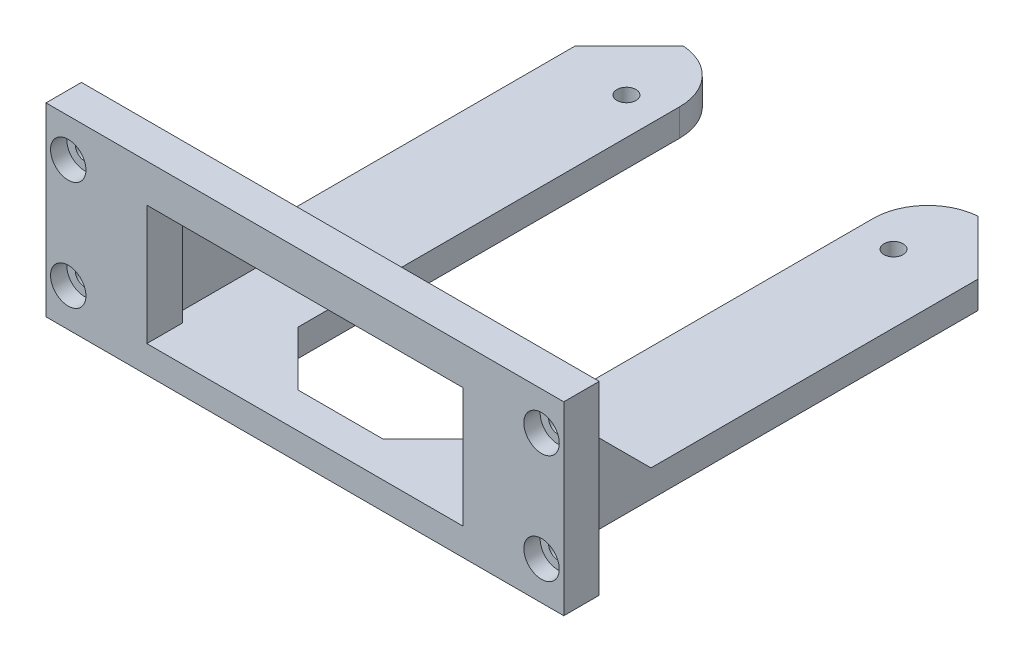
from build123d import *

# Parameters (mm, degrees)
SKETCH1_W                      = 95
SKETCH1_H                      = 34
BOSS_EXTRUDE1_DEPTH            = 6.5
SKETCH2_W                      = 74
SKETCH2_H                      = 5
BOSS_EXTRUDE2_DEPTH            = 90
SKETCH3_W                      = 58
SKETCH3_H                      = 22
CUT_EXTRUDE1_DEPTH             = 90
CBORE_FOR_M3_SHCS1_D           = 3.4
CBORE_FOR_M3_SHCS1_DEPTH       = 10.1
CBORE_FOR_M3_SHCS1_CBORE_D     = 6.5
CBORE_FOR_M3_SHCS1_CBORE_DEPTH = 3
CBORE_FOR_M3_SHCS1_TIP         = 1.021463052
SKETCH7_W                      = 6
SKETCH7_H                      = 20
BOSS_EXTRUDE3_DEPTH            = 20
CHAMFER1_SIZE                  = 20
F_1_0_3_5_DIAMETER_HOLE1_D     = 3.5
F_1_0_3_5_DIAMETER_HOLE1_DEPTH = 10.1
F_1_0_3_5_DIAMETER_HOLE1_TIP   = 1.051506083
SKETCH12_W                     = 35.5
SKETCH12_H                     = 90
CUT_EXTRUDE2_DEPTH             = 20
CHAMFER2_SIZE                  = 10
FILLET1_R                      = 10


# Some blends are built 0.0001 mm under size
with BuildPart() as part:
    # Sketch1 → Boss-Extrude1 (new body)
    with BuildSketch(Plane.XY):
        Rectangle(SKETCH1_W, SKETCH1_H)
    extrude(amount=BOSS_EXTRUDE1_DEPTH)

    # Sketch2 → Boss-Extrude2 (add)
    with BuildSketch(Plane(origin=(0, 0, 0), x_dir=(-1, 0, 0), z_dir=(0, 0, -1))):
        with Locations((0, -14.5)):
            Rectangle(SKETCH2_W, SKETCH2_H)
    extrude(amount=BOSS_EXTRUDE2_DEPTH)

    # Sketch3 → Cut-Extrude1 (cut)
    with BuildSketch(Plane(origin=(0, 0, 0), x_dir=(-1, 0, 0), z_dir=(0, 0, -1))):
        with Locations((0, -1)):
            Rectangle(SKETCH3_W, SKETCH3_H)
    extrude(amount=-CUT_EXTRUDE1_DEPTH, mode=Mode.SUBTRACT)

    # CBORE for M3 SHCS1
    with Locations(Plane.XY.offset(6.5)):
        with Locations((-43.42, 10), (-43.42, -10), (43.42, 10), (43.42, -10)):
            CounterBoreHole(CBORE_FOR_M3_SHCS1_D / 2, CBORE_FOR_M3_SHCS1_CBORE_D / 2, CBORE_FOR_M3_SHCS1_CBORE_DEPTH, depth=CBORE_FOR_M3_SHCS1_DEPTH)
            with Locations((0, 0, -(CBORE_FOR_M3_SHCS1_DEPTH + CBORE_FOR_M3_SHCS1_TIP / 2))):  # 118° drill point
                Cone(0, CBORE_FOR_M3_SHCS1_D / 2, CBORE_FOR_M3_SHCS1_TIP, mode=Mode.SUBTRACT)

    # Sketch7 → Boss-Extrude3 (add)
    with BuildSketch(Plane(origin=(0, 0, 0), x_dir=(-1, 0, 0), z_dir=(0, 0, -1))):
        with Locations((-34, -2)):
            Rectangle(SKETCH7_W, SKETCH7_H)
        with Locations((34, -2)):
            Rectangle(SKETCH7_W, SKETCH7_H)
    extrude(amount=BOSS_EXTRUDE3_DEPTH)

    # Chamfer1
    chamfer1_edges = [part.edges().sort_by_distance(p)[0] for p in [
        (34, 8, -20),
        (-34, 8, -20),
    ]]
    chamfer(chamfer1_edges, length=CHAMFER1_SIZE - 0.0001)  # a hair under: the kernel refuses the full size

    # Ø1.0 (3.5) Diameter Hole1
    with Locations(Plane(origin=(0, -12, 0), x_dir=(1, 0, 0), z_dir=(0, 1, 0))):
        with Locations((-24.5, 77), (24.5, 77), (-24.5, 19), (24.5, 19)):
            Hole(F_1_0_3_5_DIAMETER_HOLE1_D / 2, depth=F_1_0_3_5_DIAMETER_HOLE1_DEPTH)
            with Locations((0, 0, -(F_1_0_3_5_DIAMETER_HOLE1_DEPTH + F_1_0_3_5_DIAMETER_HOLE1_TIP / 2))):  # 118° drill point
                Cone(0, F_1_0_3_5_DIAMETER_HOLE1_D / 2, F_1_0_3_5_DIAMETER_HOLE1_TIP, mode=Mode.SUBTRACT)

    # Sketch12 → Cut-Extrude2 (cut)
    with BuildSketch(Plane(origin=(0, -12, 0), x_dir=(1, 0, 0), z_dir=(0, 1, 0))):
        with Locations((0, 45)):
            Rectangle(SKETCH12_W, SKETCH12_H)
    extrude(amount=-CUT_EXTRUDE2_DEPTH, mode=Mode.SUBTRACT)

    # Chamfer2
    chamfer2_edges = [part.edges().sort_by_distance(p)[0] for p in [
        (17.75, -14.5, 0),
        (-17.75, -14.5, 0),
        (37, -14.5, -90),
        (-37, -14.5, -90),
    ]]
    chamfer(chamfer2_edges, length=CHAMFER2_SIZE)

    # Fillet1
    # the kernel refuses this fillet: 10 mm, written as the material it takes off along each edge
    with BuildSketch(Plane(origin=(-17.75, 12.929588344, -90), x_dir=(0, 0, 1), z_dir=(0, -1, 0))) as fillet1_piece_1:
        with BuildLine():
            CenterArc((9.971835338, 10), FILLET1_R, 184.301222305, 85.698777695)
            Line((0, 9.25), (-0.199436707, 9.235))
            ThreePointArc((-0.199436707, 9.235), (-0.2, 4.625), (-0.2, 0))
            Line((-0.2, 0), (0, -0.2))
            Line((0, -0.2), (9.971835338, -0.2))
            Line((9.971835338, -0.2), (9.971835338, 0))
        make_face()
    extrude(amount=54.859176688, mode=Mode.SUBTRACT)
    with BuildSketch(Plane(origin=(17.75, 12.929588344, -90), x_dir=(1, 0, 0), z_dir=(0, -1, 0))) as fillet1_piece_2:
        with BuildLine():
            CenterArc((10, 9.971835338), FILLET1_R, 180, 85.698777695)
            Line((0, 9.971835338), (-0.2, 9.971835338))
            Line((-0.2, 9.971835338), (-0.2, 0))
            Line((-0.2, 0), (0, -0.2))
            ThreePointArc((0, -0.2), (4.625, -0.2), (9.235, -0.199436707))
            Line((9.235, -0.199436707), (9.25, 0))
        make_face()
    extrude(amount=54.859176688, mode=Mode.SUBTRACT)


solid = part.part
